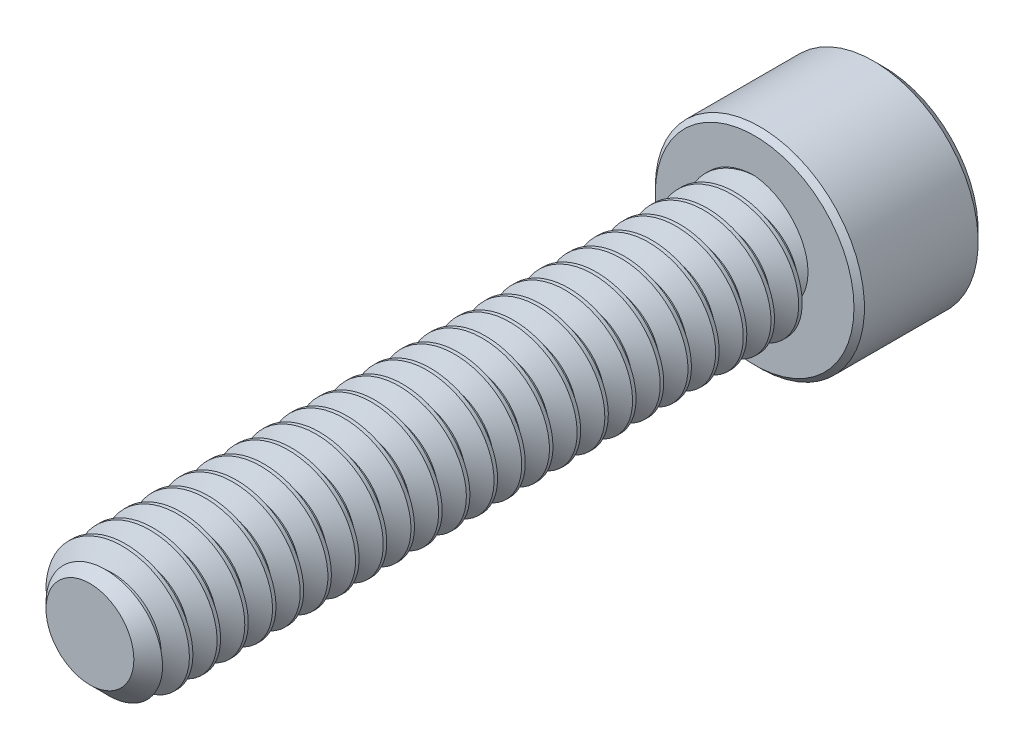
from build123d import *

# Parameters (mm, degrees)
SKETCH1_R          = 0.9271
EXTRUDE1_DEPTH     = 9.525
CHAMFER3_SIZE      = 0.29765625
CUT_SWEEP1_PITCH   = 0.396875
SKETCH6_R          = 1.4986
EXTRUDE2_DEPTH     = 1.8542
CUT_EXTRUDE1_DEPTH = 1.190625
CHAMFER1_SIZE      = 0.14986
CHAMFER2_SIZE      = 0.07493


with BuildPart() as part:
    # Sketch1 → Extrude1 (new body)
    with BuildSketch(Plane.XY):
        Circle(SKETCH1_R)
    extrude(amount=-EXTRUDE1_DEPTH)

    # Chamfer3
    chamfer3_edges = [part.edges().sort_by_distance(p)[0] for p in [
        (-0.9271, 0, 0),
    ]]
    chamfer(chamfer3_edges, length=CHAMFER3_SIZE)

    # Cut-Sweep1: the profile of Sketch3 profile screwed along a right-hand helix of 25 turns, 6 arcs to a turn; built about Z, then put on its axis
    cut_sweep1_z = Axis((0, 0, 0), (0, 0, 1))
    cut_sweep1_corners = [(0.9274, 0, -0.34743883), (0.669322126, 0, -0.1984375), (0.669322126, 0, -0.148828125), (0.9274, 0, 0.000173205)]
    with BuildLine(mode=Mode.PRIVATE) as cut_sweep1_profile:
        Line(cut_sweep1_corners[0], cut_sweep1_corners[1])
        Line(cut_sweep1_corners[1], cut_sweep1_corners[2])
        Line(cut_sweep1_corners[2], cut_sweep1_corners[3])
        Line(cut_sweep1_corners[3], cut_sweep1_corners[0])
    cut_sweep1_cap = Face(cut_sweep1_profile.wire())
    cut_sweep1_turn_angles = [0, 30, 60, 90, 120, 150, 180, 210, 240, 270, 300, 330, 360]
    cut_sweep1_turn_weights = [1, 0.8660254037844387, 1, 0.8660254037844387, 1, 0.8660254037844387, 1, 0.8660254037844387, 1, 0.8660254037844387, 1, 0.8660254037844387, 1]
    cut_sweep1_turn_rails = [Edge.make_bspline([Vector(p[0], p[1], 0).rotate(cut_sweep1_z, cut_sweep1_turn_angles[k]) / cut_sweep1_turn_weights[k] + Vector(0, 0, p[2] + CUT_SWEEP1_PITCH * cut_sweep1_turn_angles[k] / 360) for k in range(13)], [0, 0, 0, 1, 1, 2, 2, 3, 3, 4, 4, 5, 5, 6, 6, 6], 2, cut_sweep1_turn_weights) for p in cut_sweep1_corners]
    cut_sweep1_turn_sides = [Face.make_surface_from_curves(cut_sweep1_turn_rails[p[0]], cut_sweep1_turn_rails[p[1]]) for p in [(0, 1), (1, 2), (2, 3), (3, 0)]]
    cut_sweep1 = Plane(origin=(0, 0, 0), x_dir=(0, 1, 0), z_dir=(0, 0, -1)) * Solid(Shell([*[p.moved(Location((0, 0, CUT_SWEEP1_PITCH * i))) for i in range(25) for p in cut_sweep1_turn_sides], cut_sweep1_cap, cut_sweep1_cap.rotate(cut_sweep1_z, 9000).moved(Location((0, 0, CUT_SWEEP1_PITCH * 9000 / 360)))]))
    add(cut_sweep1, mode=Mode.SUBTRACT)

    # Sketch6 → Extrude2 (add)
    with BuildSketch(Plane(origin=(0, 0, -9.525), x_dir=(-1, 0, 0), z_dir=(0, 0, -1))):
        Circle(SKETCH6_R)
    extrude(amount=EXTRUDE2_DEPTH)

    # Sketch7 → Cut-Extrude1 (cut)
    with BuildSketch(Plane(origin=(0, 0, -11.3792), x_dir=(-1, 0, 0), z_dir=(0, 0, -1))):
        Polygon((0, 0.916543552), (-0.79375, 0.458271776), (-0.79375, -0.458271776), (0, -0.916543552), (0.79375, -0.458271776), (0.79375, 0.458271776), align=None)
    extrude(amount=-CUT_EXTRUDE1_DEPTH, mode=Mode.SUBTRACT)

    # Cut-Extrude2 cone 1 section (through the dimple's axis) → Cut-Extrude2 (revolve, cut)
    with BuildSketch(Plane(origin=(0, 0, -11.3792), x_dir=(0, 1, 0), z_dir=(1, 0, 0))):
        Polygon((0, 0), (0.916543552, 0), (0, 0.916543552), align=None)
    revolve(axis=Axis((0, 0, -11.3792), (0, 0, 1)), mode=Mode.SUBTRACT)

    # Chamfer1
    chamfer1_edges = [part.edges().sort_by_distance(p)[0] for p in [
        (1.4986, 0, -11.3792),
    ]]
    chamfer(chamfer1_edges, length=CHAMFER1_SIZE)

    # Chamfer2
    chamfer2_edges = [part.edges().sort_by_distance(p)[0] for p in [
        (1.4986, 0, -9.525),
    ]]
    chamfer(chamfer2_edges, length=CHAMFER2_SIZE)


solid = part.part
